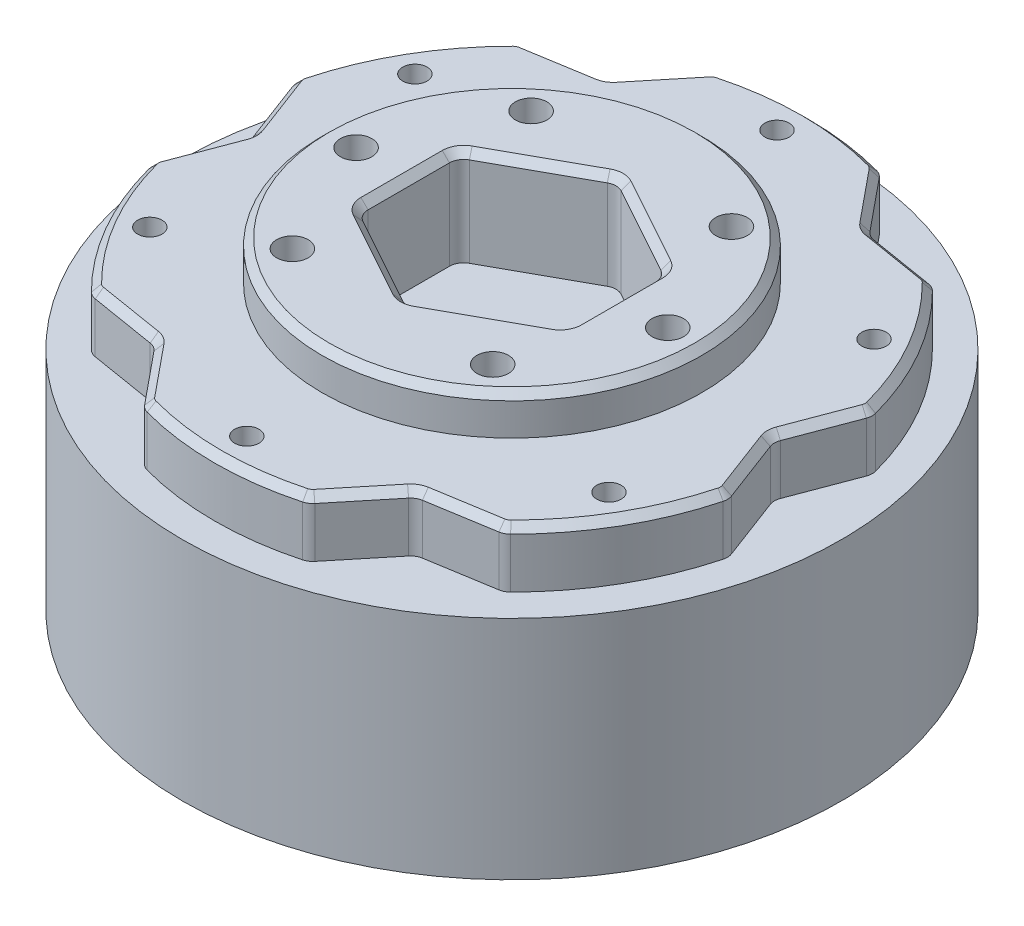
from build123d import *

# Parameters (mm, degrees)
SKETCH_1_R                   = 46
EXTRUDE_1_DEPTH              = 31.6
SKETCH_2_R                   = 41.5
EXTRUDE_2_DEPTH              = 8
SKETCH_3_R                   = 26.5
EXTRUDE_3_DEPTH              = 13.5
SKETCH_4_R                   = 2.2
CUT_EXTRUDE_1_DEPTH          = 80.158132873
HOLE_WIZARD_M3_1_D           = 3.4
HOLE_WIZARD_M3_1_CBORE_D     = 6
HOLE_WIZARD_M3_1_CBORE_DEPTH = 3.4
SKETCH_9_W                   = 30
SKETCH_9_H                   = 15
EXTRUDE_4_DEPTH              = 4
CUT_EXTRUDE_2_DEPTH          = 2.6
CUT_EXTRUDE_3_DEPTH          = 3.4
PATTERN_START                = 31.6
PATTERN_SKETCH_1_OUTLINE_R   = 2.2
PATTERN_SKETCH_1_DEPTH       = 3.4
CUT_EXTRUDE_5_DEPTH          = 79.313217275
CUT_EXTRUDE_6_DEPTH          = 82.50343551
FILLET_1_R                   = 2
SKETCH_16_R                  = 3
SKETCH_16_R_2                = 1.7
EXTRUDE_7_DEPTH              = 3.4
CHAMFER_1_SIZE               = 1


# Read off the part's stored shape, not the designer's step: 分割1, 草图阵列1
with BuildPart() as part:
    # 草图1 → 凸台-拉伸1 (new body)
    with BuildSketch(Plane(origin=(0, 0, 0), x_dir=(1, 0, 0), z_dir=(0, 1, 0))):
        with Locations(Location((0, 0, 0), (0, 0, 270))):
            Circle(SKETCH_1_R)
    extrude(amount=EXTRUDE_1_DEPTH)

    # 草图2 → 凸台-拉伸2 (add)
    with BuildSketch(Plane(origin=(0, 31.6, 0), x_dir=(1, 0, 0), z_dir=(0, 1, 0))):
        with Locations(Location((0, 0, 0), (0, 0, 270))):
            Circle(SKETCH_2_R)
    extrude(amount=EXTRUDE_2_DEPTH)

    # 草图3 → 凸台-拉伸3 (add)
    with BuildSketch(Plane(origin=(0, 31.6, 0), x_dir=(1, 0, 0), z_dir=(0, 1, 0))):
        with Locations(Location((0, 0, 0), (0, 0, 270))):
            Circle(SKETCH_3_R)
    extrude(amount=EXTRUDE_3_DEPTH)

    # 草图4 → 切除-拉伸1 (cut, through all)
    with BuildSketch(Plane(origin=(0, 45.1, 0), x_dir=(1, 0, 0), z_dir=(0, 1, 0))):
        with Locations(Location((-21.75, 0, 0), (0, 0, 270))):
            Circle(SKETCH_4_R)
        with Locations(Location((21.75, 0, 0), (0, 0, 270))):
            Circle(SKETCH_4_R)
        with Locations(Location((13.980630511, 16.661466638, 0), (0, 0, 270))):
            Circle(SKETCH_4_R)
        with Locations(Location((-13.980630511, 16.661466638, 0), (0, 0, 270))):
            Circle(SKETCH_4_R)
        with Locations(Location((13.980630511, -16.661466638, 0), (0, 0, 90))):
            Circle(SKETCH_4_R)
        with Locations(Location((-13.980630511, -16.661466638, 0), (0, 0, 90))):
            Circle(SKETCH_4_R)
    extrude(amount=-CUT_EXTRUDE_1_DEPTH, mode=Mode.SUBTRACT)

    # M3 六角圆柱头螺钉的柱形沉头孔1 (through all)
    with Locations(Plane(origin=(32.04293994, 39.6, -18.5), x_dir=(0, 0, 1), z_dir=(0, 1, 0))):
        with Locations((0, 0), (37, 0), (55.5, -32.04293994), (37, -64.08587988), (0, -64.08587988), (-18.5, -32.04293994)):
            CounterBoreHole(HOLE_WIZARD_M3_1_D / 2, HOLE_WIZARD_M3_1_CBORE_D / 2, HOLE_WIZARD_M3_1_CBORE_DEPTH)

    # 草图9 → 凸台-拉伸4 (add)
    with BuildSketch(Plane.XZ):
        with Locations((1.722788181, -26.5)):
            Rectangle(SKETCH_9_W, SKETCH_9_H)
    extrude(amount=EXTRUDE_4_DEPTH)


with BuildPart() as body_2:
    # Split Bodies 1: the piece on the far side of the plane
    add(part.part)
    split(bisect_by=Plane(origin=(0, 31.6, 0), x_dir=(1, 0, 0), z_dir=(0, 1, 0)), keep=Keep.BOTTOM)


with BuildPart() as part_1:
    add(part.part)

    # Split Bodies 1
    split(bisect_by=Plane(origin=(0, 31.6, 0), x_dir=(1, 0, 0), z_dir=(0, 1, 0)), keep=Keep.TOP)

    # 草图10 → 切除-拉伸2 (cut)
    with BuildSketch(Plane.XZ.offset(-31.6)):
        Polygon((33.659520694, 15.7), (35.276101447, 18.5), (33.659520694, 21.3), (30.426359186, 21.3), (28.809778433, 18.5), (30.426359186, 15.7), align=None)
        Polygon((3.233161507, 37), (1.616580754, 39.8), (-1.616580754, 39.8), (-3.233161507, 37), (-1.616580754, 34.2), (1.616580754, 34.2), align=None)
        Polygon((30.426359186, -21.3), (33.659520694, -21.3), (35.276101447, -18.5), (33.659520694, -15.7), (30.426359186, -15.7), (28.809778433, -18.5), align=None)
        Polygon((-3.233161507, -37), (-1.616580754, -39.8), (1.616580754, -39.8), (3.233161507, -37), (1.616580754, -34.2), (-1.616580754, -34.2), align=None)
        Polygon((-33.659520694, -15.7), (-35.276101447, -18.5), (-33.659520694, -21.3), (-30.426359186, -21.3), (-28.809778433, -18.5), (-30.426359186, -15.7), align=None)
        Polygon((-30.426359186, 21.3), (-33.659520694, 21.3), (-35.276101447, 18.5), (-33.659520694, 15.7), (-30.426359186, 15.7), (-28.809778433, 18.5), align=None)
    extrude(amount=-CUT_EXTRUDE_2_DEPTH, mode=Mode.SUBTRACT)

    # 草图11 → 切除-拉伸3 (cut)
    with BuildSketch(Plane.XZ.offset(-31.6)):
        Polygon((-11.931037055, 13.111466638), (-9.881443599, 16.661466638), (-11.931037055, 20.211466638), (-16.030223966, 20.211466638), (-18.079817422, 16.661466638), (-16.030223966, 13.111466638), align=None)
    extrude(amount=-CUT_EXTRUDE_3_DEPTH, mode=Mode.SUBTRACT)

    # 草图阵列1 outline → 草图阵列1 (cut)
    # profile 1 of 5: a face of its own
    with BuildSketch(Plane(origin=(0, 0, 0), x_dir=(1, 0, 0), z_dir=(0, 1, 0)).offset(PATTERN_START)):
        Polygon((18.079817422, -16.661466638), (16.030223966, -13.111466638), (11.931037055, -13.111466638), (9.881443599, -16.661466638), (11.931037055, -20.211466638), (16.030223966, -20.211466638), align=None)
        with Locations((13.980630511, -16.661466638)):
            Circle(PATTERN_SKETCH_1_OUTLINE_R, mode=Mode.SUBTRACT)
    # profile 2 of 5: a face of its own
    with BuildSketch(Plane(origin=(0, 0, 0), x_dir=(1, 0, 0), z_dir=(0, 1, 0)).offset(PATTERN_START)):
        Polygon((-9.881443599, 16.661466638), (-11.931037055, 20.211466638), (-16.030223966, 20.211466638), (-18.079817422, 16.661466638), (-16.030223966, 13.111466638), (-11.931037055, 13.111466638), align=None)
        with Locations((-13.980630511, 16.661466638)):
            Circle(PATTERN_SKETCH_1_OUTLINE_R, mode=Mode.SUBTRACT)
    # profile 3 of 5: a face of its own
    with BuildSketch(Plane(origin=(0, 0, 0), x_dir=(1, 0, 0), z_dir=(0, 1, 0)).offset(PATTERN_START)):
        Polygon((18.079817422, 16.661466638), (16.030223966, 20.211466638), (11.931037055, 20.211466638), (9.881443599, 16.661466638), (11.931037055, 13.111466638), (16.030223966, 13.111466638), align=None)
        with Locations((13.980630511, 16.661466638)):
            Circle(PATTERN_SKETCH_1_OUTLINE_R, mode=Mode.SUBTRACT)
    # profile 4 of 5: a face of its own
    with BuildSketch(Plane(origin=(0, 0, 0), x_dir=(1, 0, 0), z_dir=(0, 1, 0)).offset(PATTERN_START)):
        Polygon((25.849186911, 0), (23.799593456, 3.55), (19.700406544, 3.55), (17.650813089, 0), (19.700406544, -3.55), (23.799593456, -3.55), align=None)
        with Locations((21.75, 0)):
            Circle(PATTERN_SKETCH_1_OUTLINE_R, mode=Mode.SUBTRACT)
    # profile 5 of 5: a face of its own
    with BuildSketch(Plane(origin=(0, 0, 0), x_dir=(1, 0, 0), z_dir=(0, 1, 0)).offset(PATTERN_START)):
        Polygon((-17.650813089, 0), (-19.700406544, 3.55), (-23.799593456, 3.55), (-25.849186911, 0), (-23.799593456, -3.55), (-19.700406544, -3.55), align=None)
        with Locations((-21.75, 0)):
            Circle(PATTERN_SKETCH_1_OUTLINE_R, mode=Mode.SUBTRACT)
    extrude(amount=PATTERN_SKETCH_1_DEPTH, mode=Mode.SUBTRACT)

    # 草图14 → 切除-拉伸5 (cut, through all)
    with BuildSketch(Plane(origin=(0, 39.6, 0), x_dir=(1, 0, 0), z_dir=(0, 1, 0))):
        with BuildLine():
            Line((-11.478328335, 39.881047863), (-18.25, 31.609927238))
            Line((-18.25, 31.609927238), (-28.798836411, 29.881047863))
            ThreePointArc((-28.798836411, 29.881047863), (-20.75, 35.940054257), (-11.478328335, 39.881047863))
        make_face()
        with BuildLine():
            Line((18.25, 31.609927238), (11.478328335, 39.881047863))
            ThreePointArc((11.478328335, 39.881047863), (20.75, 35.940054257), (28.798836411, 29.881047863))
            Line((28.798836411, 29.881047863), (18.25, 31.609927238))
        make_face()
        with BuildLine():
            Line((36.5, 0), (40.277164746, 10))
            ThreePointArc((40.277164746, 10), (41.5, 0), (40.277164746, -10))
            Line((40.277164746, -10), (36.5, 0))
        make_face()
        with BuildLine():
            Line((18.25, -31.609927238), (28.798836411, -29.881047863))
            ThreePointArc((28.798836411, -29.881047863), (20.75, -35.940054257), (11.478328335, -39.881047863))
            Line((11.478328335, -39.881047863), (18.25, -31.609927238))
        make_face()
        with BuildLine():
            Line((-18.25, -31.609927238), (-11.478328335, -39.881047863))
            ThreePointArc((-11.478328335, -39.881047863), (-20.75, -35.940054257), (-28.798836411, -29.881047863))
            Line((-28.798836411, -29.881047863), (-18.25, -31.609927238))
        make_face()
        with BuildLine():
            Line((-36.5, 0), (-40.277164746, -10))
            ThreePointArc((-40.277164746, -10), (-41.5, 0), (-40.277164746, 10))
            Line((-40.277164746, 10), (-36.5, 0))
        make_face()
    extrude(amount=-CUT_EXTRUDE_5_DEPTH, mode=Mode.SUBTRACT)

    # 草图15 → 切除-拉伸6 (cut, through all)
    with BuildSketch(Plane(origin=(0, 45.1, 0), x_dir=(1, 0, 0), z_dir=(0, 1, 0))):
        Polygon((0, 14.810633012), (14.400544673, 6.859489579), (14.400544673, -6.859489579), (0, -14.810633012), (-14.400544673, -6.859489579), (-14.400544673, 6.859489579), align=None)
    extrude(amount=-CUT_EXTRUDE_6_DEPTH, mode=Mode.SUBTRACT)

    # 圆角1
    fillet_1_edges = [part_1.edges().sort_by_distance(p)[0] for p in [
        (-28.798836411, 35.6, -29.881047863),
        (-11.478328335, 35.6, -39.881047863),
        (11.478328335, 35.6, -39.881047863),
        (28.798836411, 35.6, -29.881047863),
        (40.277164746, 35.6, -10),
        (40.277164746, 35.6, 10),
        (28.798836411, 35.6, 29.881047863),
        (11.478328335, 35.6, 39.881047863),
        (-11.478328335, 35.6, 39.881047863),
        (-28.798836411, 35.6, 29.881047863),
        (-40.277164746, 35.6, 10),
        (-40.277164746, 35.6, -10),
        (-36.5, 35.6, 0),
        (-18.25, 35.6, 31.609927238),
        (18.25, 35.6, 31.609927238),
        (36.5, 35.6, 0),
        (18.25, 35.6, -31.609927238),
        (-18.25, 35.6, -31.609927238),
        (-14.400544673, 38.35, -6.859489579),
        (0, 38.35, -14.810633012),
        (14.400544673, 38.35, -6.859489579),
        (14.400544673, 38.35, 6.859489579),
        (0, 38.35, 14.810633012),
        (-14.400544673, 38.35, 6.859489579),
    ]]
    fillet(fillet_1_edges, radius=FILLET_1_R)

    # 草图16 → 凸台-拉伸7 (add)
    # profile 1 of 6: a face of its own
    with BuildSketch(Plane(origin=(0, 39.6, 0), x_dir=(1, 0, 0), z_dir=(0, 1, 0))):
        with Locations((-32.04293994, 18.5)):
            Circle(SKETCH_16_R)
        with Locations(Location((-32.04293994, 18.5, 0), (0, 0, 270))):
            Circle(SKETCH_16_R_2, mode=Mode.SUBTRACT)
    # profile 2 of 6: a face of its own
    with BuildSketch(Plane(origin=(0, 39.6, 0), x_dir=(1, 0, 0), z_dir=(0, 1, 0))):
        with Locations((0, 37)):
            Circle(SKETCH_16_R)
        with Locations(Location((0, 37, 0), (0, 0, 270))):
            Circle(SKETCH_16_R_2, mode=Mode.SUBTRACT)
    # profile 3 of 6: a face of its own
    with BuildSketch(Plane(origin=(0, 39.6, 0), x_dir=(1, 0, 0), z_dir=(0, 1, 0))):
        with Locations((32.04293994, 18.5)):
            Circle(SKETCH_16_R)
        with Locations(Location((32.04293994, 18.5, 0), (0, 0, 270))):
            Circle(SKETCH_16_R_2, mode=Mode.SUBTRACT)
    # profile 4 of 6: a face of its own
    with BuildSketch(Plane(origin=(0, 39.6, 0), x_dir=(1, 0, 0), z_dir=(0, 1, 0))):
        with Locations((0, -37)):
            Circle(SKETCH_16_R)
        with Locations(Location((0, -37, 0), (0, 0, 270))):
            Circle(SKETCH_16_R_2, mode=Mode.SUBTRACT)
    # profile 5 of 6: a face of its own
    with BuildSketch(Plane(origin=(0, 39.6, 0), x_dir=(1, 0, 0), z_dir=(0, 1, 0))):
        with Locations((-32.04293994, -18.5)):
            Circle(SKETCH_16_R)
        with Locations(Location((-32.04293994, -18.5, 0), (0, 0, 270))):
            Circle(SKETCH_16_R_2, mode=Mode.SUBTRACT)
    # profile 6 of 6: a face of its own
    with BuildSketch(Plane(origin=(0, 39.6, 0), x_dir=(1, 0, 0), z_dir=(0, 1, 0))):
        with Locations((32.04293994, -18.5)):
            Circle(SKETCH_16_R)
        with Locations(Location((32.04293994, -18.5, 0), (0, 0, 270))):
            Circle(SKETCH_16_R_2, mode=Mode.SUBTRACT)
    extrude(amount=-EXTRUDE_7_DEPTH)

    # 倒角1
    chamfer_1_edges = [part_1.edges().sort_by_distance(p)[0] for p in [
        (0, 45.1, -26.5),
        (7.166987657, 45.1, -10.85343916),
        (14.400544673, 45.1, 0),
        (7.166987657, 45.1, 10.85343916),
        (-7.166987657, 45.1, 10.85343916),
        (-14.400544673, 45.1, 0),
        (-7.166987657, 45.1, -10.85343916),
        (-35.940054257, 39.6, 20.75),
        (-38.410374763, 39.6, 5.0576951),
        (-38.410374763, 39.6, -5.0576951),
        (-23.585279822, 39.6, 30.735512764),
        (-14.82509494, 39.6, 35.793207863),
        (0, 39.6, 41.5),
        (14.82509494, 39.6, 35.793207863),
        (23.585279822, 39.6, 30.735512764),
        (35.940054257, 39.6, 20.75),
        (38.410374763, 39.6, 5.0576951),
        (38.410374763, 39.6, -5.0576951),
        (35.940054257, 39.6, -20.75),
        (23.585279822, 39.6, -30.735512764),
        (14.82509494, 39.6, -35.793207863),
        (0, 39.6, -41.5),
        (-14.82509494, 39.6, -35.793207863),
        (-23.585279822, 39.6, -30.735512764),
        (-35.940054257, 39.6, -20.75),
        (-11.418379144, 39.6, -39.803723534),
        (-40.180225317, 39.6, -10.013255358),
        (-28.761846173, 39.6, -29.790468176),
        (11.418379144, 39.6, -39.803723534),
        (28.761846173, 39.6, -29.790468176),
        (40.180225317, 39.6, -10.013255358),
        (40.180225317, 39.6, 10.013255358),
        (28.761846173, 39.6, 29.790468176),
        (11.418379144, 39.6, 39.803723534),
        (-11.418379144, 39.6, 39.803723534),
        (-28.761846173, 39.6, 29.790468176),
        (-40.180225317, 39.6, 10.013255358),
        (14.122960221, 45.1, -6.695669476),
        (14.122960221, 45.1, 6.695669476),
        (0, 45.1, 14.526023088),
        (-14.122960221, 45.1, 6.695669476),
        (0, 45.1, -14.526023088),
        (-14.122960221, 45.1, -6.695669476),
        (-18.318957312, 39.6, 31.729364806),
        (18.318957312, 39.6, 31.729364806),
        (36.637914624, 39.6, 0),
        (18.318957312, 39.6, -31.729364806),
        (-36.637914624, 39.6, 0),
        (-18.318957312, 39.6, -31.729364806),
    ]]
    chamfer(chamfer_1_edges, length=CHAMFER_1_SIZE)


solid = Compound([body_2.part, part_1.part])
